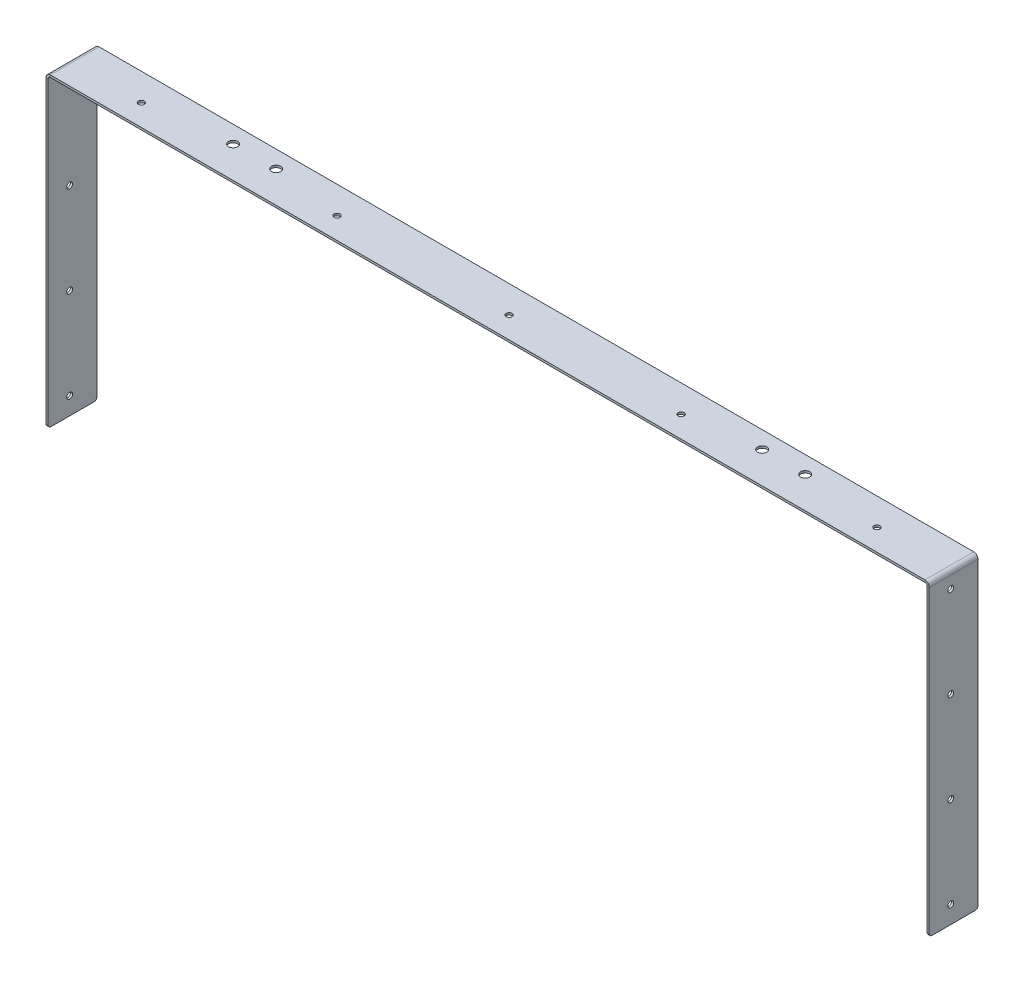
from build123d import *

# Parameters (mm, degrees)
BASE_FLANGE1_DEPTH         = 34
SKETCH2_R                  = 2.05
CUT_EXTRUDE1_DEPTH         = 654.06480536
M6_CLEARANCE_HOLE1_D       = 6.4
FILLET1_R                  = 2
F_4_1_4_1_DIAMETER_HOLE1_D = 4.1


# Sheet-metal steps are written as plain solids
with BuildPart() as part:
    # Sketch1 → Base-Flange1 (new body)
    with BuildSketch(Plane.XY):
        with BuildLine():
            Line((-308, 0), (-308, 211.2))
            ThreePointArc((-308, 211.2), (-307.121320344, 213.321320344), (-305, 214.2))
            Line((-305, 214.2), (305, 214.2))
            ThreePointArc((305, 214.2), (307.121320344, 213.321320344), (308, 211.2))
            Line((308, 211.2), (308, 0))
            Line((308, 0), (306.5, 0))
            Line((306.5, 0), (306.5, 211.2))
            ThreePointArc((306.5, 211.2), (306.060660172, 212.260660172), (305, 212.7))
            Line((305, 212.7), (-305, 212.7))
            ThreePointArc((-305, 212.7), (-306.060660172, 212.260660172), (-306.5, 211.2))
            Line((-306.5, 211.2), (-306.5, 0))
            Line((-306.5, 0), (-308, 0))
        make_face()
    extrude(amount=BASE_FLANGE1_DEPTH)

    # Sketch2 → Cut-Extrude1 (cut, through all)
    with BuildSketch(Plane.ZY.offset(308)):
        with Locations((19, 12.2)):
            Circle(SKETCH2_R)
        with Locations((19, 75.7)):
            Circle(SKETCH2_R)
        with Locations((19, 139.2)):
            Circle(SKETCH2_R)
        with Locations((19, 202.7)):
            Circle(SKETCH2_R)
    extrude(amount=-CUT_EXTRUDE1_DEPTH, mode=Mode.SUBTRACT)

    # M6 Clearance Hole1 (through all)
    with Locations(Plane(origin=(0, 214.2, 0), x_dir=(1, 0, 0), z_dir=(0, 1, 0))):
        with Locations((-199.5, -12), (-169.5, -12)):
            m6_clearance_hole1 = Hole(M6_CLEARANCE_HOLE1_D / 2)

    # Fillet1
    fillet1_edges = [part.edges().sort_by_distance(p)[0] for p in [
        (-307.25, 0, 0),
        (307.25, 0, 0),
        (-307.25, 0, 34),
        (307.25, 0, 34),
    ]]
    fillet(fillet1_edges, radius=FILLET1_R)

    # Ø4.1 (4.1) Diameter Hole1 (through all)
    with Locations(Plane(origin=(0, 214.2, 0), x_dir=(1, 0, 0), z_dir=(0, 1, 0))):
        with Locations((-256.5, -19), (-120, -19), (0, -19), (120, -19), (256.5, -19)):
            Hole(F_4_1_4_1_DIAMETER_HOLE1_D / 2)

    # Mirror1: M6 Clearance Hole1 across Right Plane
    add(m6_clearance_hole1.mirror(Plane(origin=(0, 0, 0), x_dir=(0, 0, -1), z_dir=(1, 0, 0))), mode=Mode.SUBTRACT)


solid = part.part
